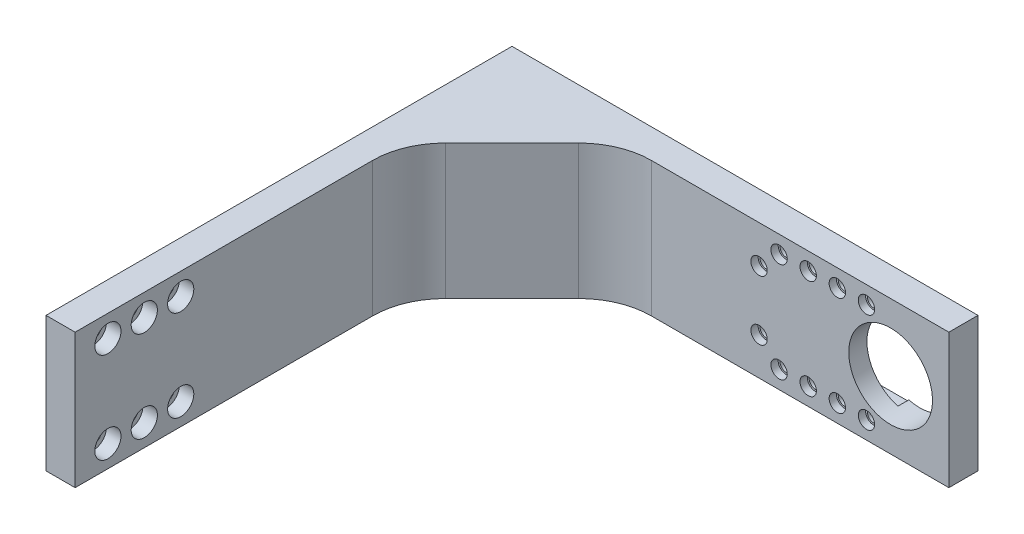
from build123d import *

# Parameters (mm, degrees)
BOSS_EXTRUDE1_DEPTH = 37
CUT_EXTRUDE1_REACH  = 186.762
CUT_EXTRUDE2_REACH  = 186.762
SKETCH3_R           = 1.75
SKETCH5_W           = 38
SKETCH5_H           = 23
CUT_EXTRUDE3_DEPTH  = 3
SKETCH6_W           = 3
SKETCH6_H           = 23
BOSS_EXTRUDE2_DEPTH = 7.5
CUT_EXTRUDE4_REACH  = 184.696
SKETCH7_R           = 1.75
SKETCH8_R           = 2.25
CUT_EXTRUDE5_DEPTH  = 2
CUT_EXTRUDE6_REACH  = 181.313
SKETCH9_R           = 2.25
SKETCH10_R          = 3.6
CUT_EXTRUDE7_DEPTH  = 4
CHAMFER1_SIZE       = 30
FILLET4_R           = 20


with BuildPart() as part:
    # Sketch1 → Boss-Extrude1 (new body)
    with BuildSketch(Plane(origin=(0, 0, 0), x_dir=(1, 0, 0), z_dir=(0, 1, 0))):
        Polygon((0, 0), (0, 128), (128, 128), (128, 120), (8, 120), (8, 0), align=None)
    extrude(amount=BOSS_EXTRUDE1_DEPTH)

    # Sketch2 → Cut-Extrude1 (cut, up to next)
    with BuildSketch(Plane(origin=(0, 0, -128), x_dir=(-1, 0, 0), z_dir=(0, 0, -1)), mode=Mode.PRIVATE) as cut_extrude1_sk1:
        with BuildLine():
            ThreePointArc((-123.5, 18.5), (-112, 7), (-100.5, 18.5))
            ThreePointArc((-100.5, 18.5), (-112, 30), (-123.5, 18.5))
        make_face()
    cut_extrude1_tool1 = extrude(cut_extrude1_sk1.sketch, amount=-CUT_EXTRUDE1_REACH, mode=Mode.PRIVATE) & part.part
    add(cut_extrude1_tool1.solids().sort_by_distance((112, 18.5, -128))[0], mode=Mode.SUBTRACT)

    # Sketch3 → Cut-Extrude2 (cut, up to next)
    with BuildSketch(Plane(origin=(0, 0, -128), x_dir=(-1, 0, 0), z_dir=(0, 0, -1)), mode=Mode.PRIVATE) as cut_extrude2_sk1:
        with Locations((-105.36, 32.19)):
            Circle(SKETCH3_R)
    cut_extrude2_tool1 = extrude(cut_extrude2_sk1.sketch, amount=-CUT_EXTRUDE2_REACH, mode=Mode.PRIVATE) & part.part
    # Sketch3 → Cut-Extrude2 (cut, up to next)
    with BuildSketch(Plane(origin=(0, 0, -128), x_dir=(-1, 0, 0), z_dir=(0, 0, -1)), mode=Mode.PRIVATE) as cut_extrude2_sk2:
        with Locations((-97.36, 32.19)):
            Circle(SKETCH3_R)
    cut_extrude2_tool2 = extrude(cut_extrude2_sk2.sketch, amount=-CUT_EXTRUDE2_REACH, mode=Mode.PRIVATE) & part.part
    # Sketch3 → Cut-Extrude2 (cut, up to next)
    with BuildSketch(Plane(origin=(0, 0, -128), x_dir=(-1, 0, 0), z_dir=(0, 0, -1)), mode=Mode.PRIVATE) as cut_extrude2_sk3:
        with Locations((-89.36, 32.19)):
            Circle(SKETCH3_R)
    cut_extrude2_tool3 = extrude(cut_extrude2_sk3.sketch, amount=-CUT_EXTRUDE2_REACH, mode=Mode.PRIVATE) & part.part
    # Sketch3 → Cut-Extrude2 (cut, up to next)
    with BuildSketch(Plane(origin=(0, 0, -128), x_dir=(-1, 0, 0), z_dir=(0, 0, -1)), mode=Mode.PRIVATE) as cut_extrude2_sk4:
        with Locations((-81.36, 32.19)):
            Circle(SKETCH3_R)
    cut_extrude2_tool4 = extrude(cut_extrude2_sk4.sketch, amount=-CUT_EXTRUDE2_REACH, mode=Mode.PRIVATE) & part.part
    # Sketch3 → Cut-Extrude2 (cut, up to next)
    with BuildSketch(Plane(origin=(0, 0, -128), x_dir=(-1, 0, 0), z_dir=(0, 0, -1)), mode=Mode.PRIVATE) as cut_extrude2_sk5:
        with Locations((-81.36, 4.81)):
            Circle(SKETCH3_R)
    cut_extrude2_tool5 = extrude(cut_extrude2_sk5.sketch, amount=-CUT_EXTRUDE2_REACH, mode=Mode.PRIVATE) & part.part
    # Sketch3 → Cut-Extrude2 (cut, up to next)
    with BuildSketch(Plane(origin=(0, 0, -128), x_dir=(-1, 0, 0), z_dir=(0, 0, -1)), mode=Mode.PRIVATE) as cut_extrude2_sk6:
        with Locations((-89.36, 4.81)):
            Circle(SKETCH3_R)
    cut_extrude2_tool6 = extrude(cut_extrude2_sk6.sketch, amount=-CUT_EXTRUDE2_REACH, mode=Mode.PRIVATE) & part.part
    # Sketch3 → Cut-Extrude2 (cut, up to next)
    with BuildSketch(Plane(origin=(0, 0, -128), x_dir=(-1, 0, 0), z_dir=(0, 0, -1)), mode=Mode.PRIVATE) as cut_extrude2_sk7:
        with Locations((-97.36, 4.81)):
            Circle(SKETCH3_R)
    cut_extrude2_tool7 = extrude(cut_extrude2_sk7.sketch, amount=-CUT_EXTRUDE2_REACH, mode=Mode.PRIVATE) & part.part
    # Sketch3 → Cut-Extrude2 (cut, up to next)
    with BuildSketch(Plane(origin=(0, 0, -128), x_dir=(-1, 0, 0), z_dir=(0, 0, -1)), mode=Mode.PRIVATE) as cut_extrude2_sk8:
        with Locations((-105.36, 4.81)):
            Circle(SKETCH3_R)
    cut_extrude2_tool8 = extrude(cut_extrude2_sk8.sketch, amount=-CUT_EXTRUDE2_REACH, mode=Mode.PRIVATE) & part.part
    # Sketch3 → Cut-Extrude2 (cut, up to next)
    with BuildSketch(Plane(origin=(0, 0, -128), x_dir=(-1, 0, 0), z_dir=(0, 0, -1)), mode=Mode.PRIVATE) as cut_extrude2_sk9:
        with Locations((-75.86, 26.69)):
            Circle(SKETCH3_R)
    cut_extrude2_tool9 = extrude(cut_extrude2_sk9.sketch, amount=-CUT_EXTRUDE2_REACH, mode=Mode.PRIVATE) & part.part
    # Sketch3 → Cut-Extrude2 (cut, up to next)
    with BuildSketch(Plane(origin=(0, 0, -128), x_dir=(-1, 0, 0), z_dir=(0, 0, -1)), mode=Mode.PRIVATE) as cut_extrude2_sk10:
        with Locations((-75.86, 10.31)):
            Circle(SKETCH3_R)
    cut_extrude2_tool10 = extrude(cut_extrude2_sk10.sketch, amount=-CUT_EXTRUDE2_REACH, mode=Mode.PRIVATE) & part.part
    add(cut_extrude2_tool1.solids().sort_by_distance((105.36, 32.19, -128))[0], mode=Mode.SUBTRACT)
    add(cut_extrude2_tool2.solids().sort_by_distance((97.36, 32.19, -128))[0], mode=Mode.SUBTRACT)
    add(cut_extrude2_tool3.solids().sort_by_distance((89.36, 32.19, -128))[0], mode=Mode.SUBTRACT)
    add(cut_extrude2_tool4.solids().sort_by_distance((81.36, 32.19, -128))[0], mode=Mode.SUBTRACT)
    add(cut_extrude2_tool5.solids().sort_by_distance((81.36, 4.81, -128))[0], mode=Mode.SUBTRACT)
    add(cut_extrude2_tool6.solids().sort_by_distance((89.36, 4.81, -128))[0], mode=Mode.SUBTRACT)
    add(cut_extrude2_tool7.solids().sort_by_distance((97.36, 4.81, -128))[0], mode=Mode.SUBTRACT)
    add(cut_extrude2_tool8.solids().sort_by_distance((105.36, 4.81, -128))[0], mode=Mode.SUBTRACT)
    add(cut_extrude2_tool9.solids().sort_by_distance((75.86, 26.69, -128))[0], mode=Mode.SUBTRACT)
    add(cut_extrude2_tool10.solids().sort_by_distance((75.86, 10.31, -128))[0], mode=Mode.SUBTRACT)

    # Sketch5 → Cut-Extrude3 (cut)
    with BuildSketch(Plane(origin=(0, 0, -128), x_dir=(-1, 0, 0), z_dir=(0, 0, -1))):
        with Locations((-90, 18.5)):
            Rectangle(SKETCH5_W, SKETCH5_H)
    extrude(amount=-CUT_EXTRUDE3_DEPTH, mode=Mode.SUBTRACT)

    # Sketch6 → Boss-Extrude2 (add)
    with BuildSketch(Plane(origin=(71, 0, 0), x_dir=(0, 0, -1), z_dir=(1, 0, 0))):
        with Locations((126.5, 18.5)):
            Rectangle(SKETCH6_W, SKETCH6_H)
    extrude(amount=BOSS_EXTRUDE2_DEPTH)

    # Sketch7 → Cut-Extrude4 (cut, up to next)
    with BuildSketch(Plane.XY.offset(-125), mode=Mode.PRIVATE) as cut_extrude4_sk1:
        with Locations((75.86, 10.31)):
            Circle(SKETCH7_R)
    cut_extrude4_tool1 = extrude(cut_extrude4_sk1.sketch, amount=-CUT_EXTRUDE4_REACH, mode=Mode.PRIVATE) & part.part
    # Sketch7 → Cut-Extrude4 (cut, up to next)
    with BuildSketch(Plane.XY.offset(-125), mode=Mode.PRIVATE) as cut_extrude4_sk2:
        with Locations((75.86, 26.69)):
            Circle(SKETCH7_R)
    cut_extrude4_tool2 = extrude(cut_extrude4_sk2.sketch, amount=-CUT_EXTRUDE4_REACH, mode=Mode.PRIVATE) & part.part
    add(cut_extrude4_tool1.solids().sort_by_distance((75.86, 10.31, -125))[0], mode=Mode.SUBTRACT)
    add(cut_extrude4_tool2.solids().sort_by_distance((75.86, 26.69, -125))[0], mode=Mode.SUBTRACT)

    # Sketch8 → Cut-Extrude5 (cut)
    with BuildSketch(Plane.XY.offset(-120)):
        with Locations((75.86, 10.31)):
            Circle(SKETCH8_R)
        with Locations((75.86, 26.69)):
            Circle(SKETCH8_R)
        with Locations((81.36, 32.19)):
            Circle(SKETCH8_R)
        with Locations((89.36, 32.19)):
            Circle(SKETCH8_R)
        with Locations((97.36, 32.19)):
            Circle(SKETCH8_R)
        with Locations((105.36, 32.19)):
            Circle(SKETCH8_R)
        with Locations((105.36, 4.81)):
            Circle(SKETCH8_R)
        with Locations((97.36, 4.81)):
            Circle(SKETCH8_R)
        with Locations((89.36, 4.81)):
            Circle(SKETCH8_R)
        with Locations((81.36, 4.81)):
            Circle(SKETCH8_R)
    extrude(amount=-CUT_EXTRUDE5_DEPTH, mode=Mode.SUBTRACT)

    # Sketch9 → Cut-Extrude6 (cut, up to next)
    with BuildSketch(Plane(origin=(8, 0, 0), x_dir=(0, 0, -1), z_dir=(1, 0, 0)), mode=Mode.PRIVATE) as cut_extrude6_sk1:
        with Locations((9, 6)):
            Circle(SKETCH9_R)
    cut_extrude6_tool1 = extrude(cut_extrude6_sk1.sketch, amount=-CUT_EXTRUDE6_REACH, mode=Mode.PRIVATE) & part.part
    # Sketch9 → Cut-Extrude6 (cut, up to next)
    with BuildSketch(Plane(origin=(8, 0, 0), x_dir=(0, 0, -1), z_dir=(1, 0, 0)), mode=Mode.PRIVATE) as cut_extrude6_sk2:
        with Locations((19, 6)):
            Circle(SKETCH9_R)
    cut_extrude6_tool2 = extrude(cut_extrude6_sk2.sketch, amount=-CUT_EXTRUDE6_REACH, mode=Mode.PRIVATE) & part.part
    # Sketch9 → Cut-Extrude6 (cut, up to next)
    with BuildSketch(Plane(origin=(8, 0, 0), x_dir=(0, 0, -1), z_dir=(1, 0, 0)), mode=Mode.PRIVATE) as cut_extrude6_sk3:
        with Locations((29, 6)):
            Circle(SKETCH9_R)
    cut_extrude6_tool3 = extrude(cut_extrude6_sk3.sketch, amount=-CUT_EXTRUDE6_REACH, mode=Mode.PRIVATE) & part.part
    # Sketch9 → Cut-Extrude6 (cut, up to next)
    with BuildSketch(Plane(origin=(8, 0, 0), x_dir=(0, 0, -1), z_dir=(1, 0, 0)), mode=Mode.PRIVATE) as cut_extrude6_sk4:
        with Locations((29, 31)):
            Circle(SKETCH9_R)
    cut_extrude6_tool4 = extrude(cut_extrude6_sk4.sketch, amount=-CUT_EXTRUDE6_REACH, mode=Mode.PRIVATE) & part.part
    # Sketch9 → Cut-Extrude6 (cut, up to next)
    with BuildSketch(Plane(origin=(8, 0, 0), x_dir=(0, 0, -1), z_dir=(1, 0, 0)), mode=Mode.PRIVATE) as cut_extrude6_sk5:
        with Locations((9, 31)):
            Circle(SKETCH9_R)
    cut_extrude6_tool5 = extrude(cut_extrude6_sk5.sketch, amount=-CUT_EXTRUDE6_REACH, mode=Mode.PRIVATE) & part.part
    # Sketch9 → Cut-Extrude6 (cut, up to next)
    with BuildSketch(Plane(origin=(8, 0, 0), x_dir=(0, 0, -1), z_dir=(1, 0, 0)), mode=Mode.PRIVATE) as cut_extrude6_sk6:
        with Locations((19, 31)):
            Circle(SKETCH9_R)
    cut_extrude6_tool6 = extrude(cut_extrude6_sk6.sketch, amount=-CUT_EXTRUDE6_REACH, mode=Mode.PRIVATE) & part.part
    add(cut_extrude6_tool1.solids().sort_by_distance((8, 6, -9))[0], mode=Mode.SUBTRACT)
    add(cut_extrude6_tool2.solids().sort_by_distance((8, 6, -19))[0], mode=Mode.SUBTRACT)
    add(cut_extrude6_tool3.solids().sort_by_distance((8, 6, -29))[0], mode=Mode.SUBTRACT)
    add(cut_extrude6_tool4.solids().sort_by_distance((8, 31, -29))[0], mode=Mode.SUBTRACT)
    add(cut_extrude6_tool5.solids().sort_by_distance((8, 31, -9))[0], mode=Mode.SUBTRACT)
    add(cut_extrude6_tool6.solids().sort_by_distance((8, 31, -19))[0], mode=Mode.SUBTRACT)

    # Sketch10 → Cut-Extrude7 (cut)
    with BuildSketch(Plane(origin=(8, 0, 0), x_dir=(0, 0, -1), z_dir=(1, 0, 0))):
        with Locations((9, 31)):
            Circle(SKETCH10_R)
        with Locations((19, 31)):
            Circle(SKETCH10_R)
        with Locations((29, 31)):
            Circle(SKETCH10_R)
        with Locations((29, 6)):
            Circle(SKETCH10_R)
        with Locations((19, 6)):
            Circle(SKETCH10_R)
        with Locations((9, 6)):
            Circle(SKETCH10_R)
    extrude(amount=-CUT_EXTRUDE7_DEPTH, mode=Mode.SUBTRACT)

    # Chamfer1
    chamfer1_edges = [part.edges().sort_by_distance(p)[0] for p in [
        (8, 18.5, -120),
    ]]
    chamfer(chamfer1_edges, length=CHAMFER1_SIZE)

    # Fillet4
    fillet4_edges = [part.edges().sort_by_distance(p)[0] for p in [
        (38, 18.5, -120),
        (8, 18.5, -90),
    ]]
    fillet(fillet4_edges, radius=FILLET4_R)


solid = part.part
